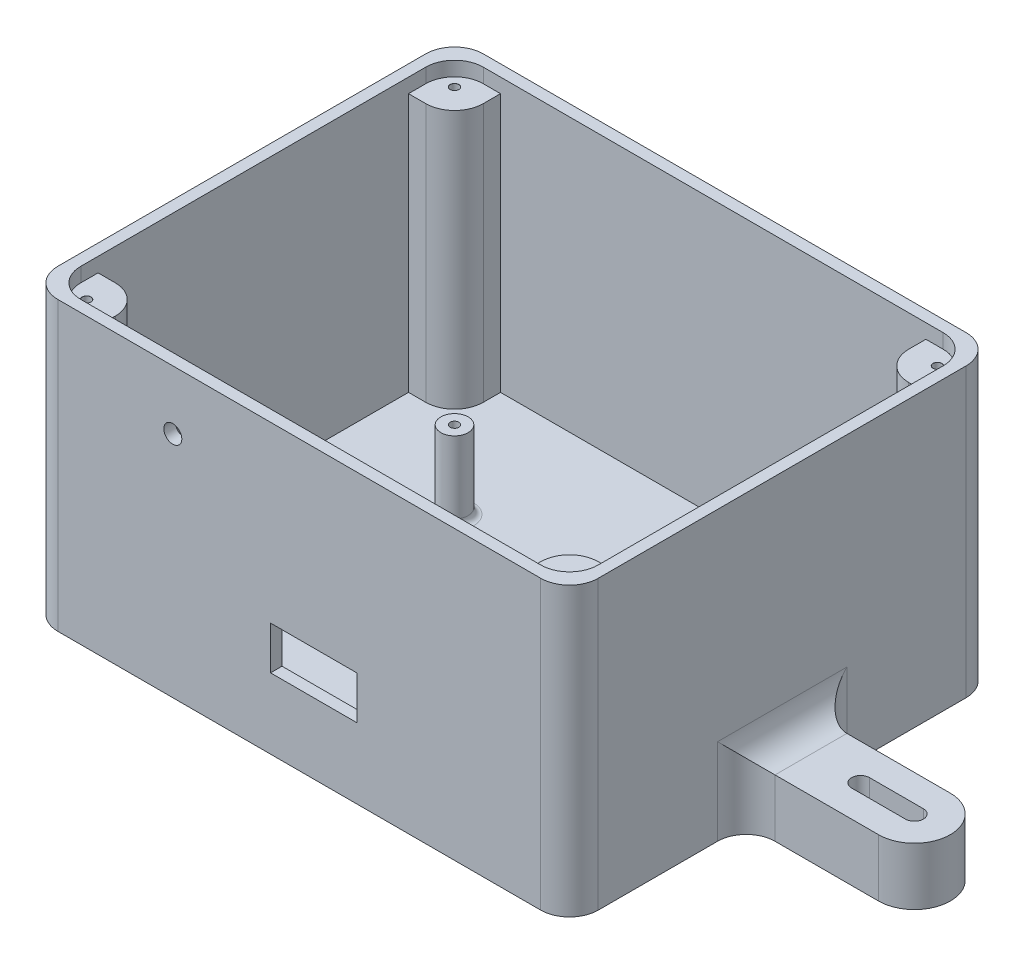
from build123d import *

# Parameters (mm, degrees)
ESBO_O1_W                                  = 4.75
ESBO_O1_H                                  = 1
REVOLU_O1_ANGLE                            = 180
ESBO_O2_W                                  = 9.5
ESBO_O2_H                                  = 74
RESSALTO_EXTRUS_O1_DEPTH                   = 8.75
ESBO_O3_W                                  = 8.75
ESBO_O3_H                                  = 73
CORTE_EXTRUS_O1_DEPTH                      = 1.5
ESBO_O4_W                                  = 8
ESBO_O4_H                                  = 73
CORTE_EXTRUS_O2_DEPTH                      = 4.75
ESBO_O5_W                                  = 4
ESBO_O5_H                                  = 68
RESSALTO_EXTRUS_O2_DEPTH                   = 52
ESBO_O6_W                                  = 4
ESBO_O6_H                                  = 74
RESSALTO_EXTRUS_O3_DEPTH                   = 80
ESBO_O7_W                                  = 4
ESBO_O7_H                                  = 74
RESSALTO_EXTRUS_O4_DEPTH                   = 40
ESBO_O8_W                                  = 144
ESBO_O8_H                                  = 74
RESSALTO_EXTRUS_O5_DEPTH                   = 4
ESBO_O9_W                                  = 144
ESBO_O9_H                                  = 74
RESSALTO_EXTRUS_O6_DEPTH                   = 4
ESBO_O10_W                                 = 188
ESBO_O10_H                                 = 74
RESSALTO_EXTRUS_O7_DEPTH                   = 4
ESBO_O11_W                                 = 188
ESBO_O11_H                                 = 148
RESSALTO_EXTRUS_O8_DEPTH                   = 26
CORTE_EXTRUS_O3_DEPTH                      = 21
RESSALTO_EXTRUS_O9_DEPTH                   = 20
CORTE_EXTRUS_O4_DEPTH                      = 268.847437919
RESSALTO_EXTRUS_O10_DEPTH                  = 20
CORTE_EXTRUS_O5_DEPTH                      = 262.040705638
ESBO_O17_W                                 = 16
ESBO_O17_H                                 = 16
RESSALTO_EXTRUS_O11_DEPTH                  = 90
ESBO_O18_W                                 = 16
ESBO_O18_H                                 = 16
RESSALTO_EXTRUS_O12_DEPTH                  = 90
ESBO_O19_W                                 = 16
ESBO_O19_H                                 = 16
RESSALTO_EXTRUS_O13_DEPTH                  = 90
ESBO_O20_W                                 = 16
ESBO_O20_H                                 = 16
RESSALTO_EXTRUS_O14_DEPTH                  = 90
RESSALTO_EXTRUS_O15_DEPTH                  = 22
ESBO_O22_W                                 = 4.75
ESBO_O22_H                                 = 22
FURO_DE_DI_METRO_3_0_3_1_D                 = 3
FURO_DE_DI_METRO_3_0_3_1_DEPTH             = 15
FURO_DE_DI_METRO_3_0_3_1_TIP               = 0.901290929
FURO_DE_DI_METRO_3_0_3_2_D                 = 3
FURO_DE_DI_METRO_3_0_3_2_DEPTH             = 15
FURO_DE_DI_METRO_3_0_3_2_TIP               = 0.901290929
BROCA_DE_ROSQUEAR_PARA_HELICOIDE_M61_D     = 6.25
BROCA_DE_ROSQUEAR_PARA_HELICOIDE_M61_DEPTH = 4
CHANFRO1_SIZE                              = 0.025
FILETE1_R                                  = 2
FILETE2_R                                  = 10
ESBO_O35_W                                 = 4.75
ESBO_O35_H                                 = 22
FILETE3_R                                  = 2
ESBO_O43_W                                 = 52
ESBO_O43_H                                 = 6
RESSALTO_EXTRUS_O16_DEPTH                  = 4
ESBO_O44_R                                 = 4.75
ESBO_O44_R_2                               = 1.525
RESSALTO_EXTRUS_O17_DEPTH                  = 5
ESBO_O47_W                                 = 30
ESBO_O47_H                                 = 15
CORTE_EXTRUS_O7_DEPTH                      = 10


with BuildPart() as part:
    # Esboço1 → Revolução1 (revolve)
    with BuildSketch(Plane.XY.offset(-4.75)):
        with Locations((97.625, 26.5)):
            Rectangle(ESBO_O1_W, ESBO_O1_H)
    revolve(axis=Axis((95.25, 27, -4.75), (0, 1, 0)), revolution_arc=REVOLU_O1_ANGLE)

    # Esboço2 → Ressalto-extrusão1 (add)
    with BuildSketch(Plane.XY.offset(-4.75)):
        with Locations((95.25, 63)):
            Rectangle(ESBO_O2_W, ESBO_O2_H)
    extrude(amount=RESSALTO_EXTRUS_O1_DEPTH)

    # Esboço3 → Corte-extrusão1 (cut)
    with BuildSketch(Plane.ZY.offset(-90.5)):
        with Locations((-0.375, 63.5)):
            Rectangle(ESBO_O3_W, ESBO_O3_H)
    extrude(amount=-CORTE_EXTRUS_O1_DEPTH, mode=Mode.SUBTRACT)

    # Esboço4 → Corte-extrusão2 (cut)
    with BuildSketch(Plane(origin=(0, 0, -4.75), x_dir=(-1, 0, 0), z_dir=(0, 0, -1))):
        with Locations((-96, 63.5)):
            Rectangle(ESBO_O4_W, ESBO_O4_H)
    extrude(amount=-CORTE_EXTRUS_O2_DEPTH, mode=Mode.SUBTRACT)

    # Esboço5 → Ressalto-extrusão2 (add)
    with BuildSketch(Plane.ZY.offset(-92)):
        with Locations((2, 66)):
            Rectangle(ESBO_O5_W, ESBO_O5_H)
    extrude(amount=RESSALTO_EXTRUS_O2_DEPTH)

    # Esboço6 → Ressalto-extrusão3 (add)
    with BuildSketch(Plane.ZY.offset(-40)):
        with Locations((2, 63)):
            Rectangle(ESBO_O6_W, ESBO_O6_H)
    extrude(amount=RESSALTO_EXTRUS_O3_DEPTH)

    # Esboço7 → Ressalto-extrusão4 (add)
    with BuildSketch(Plane(origin=(100, 0, 0), x_dir=(0, 0, -1), z_dir=(1, 0, 0))):
        with Locations((-2, 63)):
            Rectangle(ESBO_O7_W, ESBO_O7_H)
    extrude(amount=RESSALTO_EXTRUS_O4_DEPTH)

    # Esboço8 → Ressalto-extrusão5 (add)
    with BuildSketch(Plane(origin=(140, 0, 0), x_dir=(0, 0, -1), z_dir=(1, 0, 0))):
        with Locations((68, 63)):
            Rectangle(ESBO_O8_W, ESBO_O8_H)
    extrude(amount=RESSALTO_EXTRUS_O5_DEPTH)

    # Esboço9 → Ressalto-extrusão6 (add)
    with BuildSketch(Plane.ZY.offset(40)):
        with Locations((-68, 63)):
            Rectangle(ESBO_O9_W, ESBO_O9_H)
    extrude(amount=RESSALTO_EXTRUS_O6_DEPTH)

    # Esboço10 → Ressalto-extrusão7 (add)
    with BuildSketch(Plane(origin=(0, 0, -140), x_dir=(-1, 0, 0), z_dir=(0, 0, -1))):
        with Locations((-50, 63)):
            Rectangle(ESBO_O10_W, ESBO_O10_H)
    extrude(amount=RESSALTO_EXTRUS_O7_DEPTH)

    # Esboço11 → Ressalto-extrusão8 (add)
    with BuildSketch(Plane.XZ.offset(-26)):
        with Locations((50, -70)):
            Rectangle(ESBO_O11_W, ESBO_O11_H)
    extrude(amount=RESSALTO_EXTRUS_O8_DEPTH)

    # Esboço12 → Corte-extrusão3 (cut)
    with BuildSketch(Plane(origin=(0, 26, 0), x_dir=(-1, 0, 0), z_dir=(0, 1, 0))):
        with BuildLine():
            Line((-140, -140), (40, -140))
            Line((40, -140), (40, 0))
            Line((40, 0), (-90.5, 0))
            Line((-90.5, 0), (-90.5, -4.75))
            ThreePointArc((-90.5, -4.75), (-95.25, -9.5), (-100, -4.75))
            Line((-100, -4.75), (-100, 0))
            Line((-100, 0), (-140, 0))
            Line((-140, 0), (-140, -140))
        make_face()
    extrude(amount=-CORTE_EXTRUS_O3_DEPTH, mode=Mode.SUBTRACT)

    # Esboço13 → Ressalto-extrusão9 (add)
    with BuildSketch(Plane.XZ):
        with BuildLine():
            Line((144, -82.5), (190, -82.5))
            ThreePointArc((190, -82.5), (202.5, -70), (190, -57.5))
            Line((190, -57.5), (144, -57.5))
            Line((144, -57.5), (144, -82.5))
        make_face()
    extrude(amount=-RESSALTO_EXTRUS_O9_DEPTH)

    # Esboço14 → Corte-extrusão4 (cut, through all)
    with BuildSketch(Plane.XZ):
        with BuildLine():
            Line((190, -66.875), (171.25, -66.875))
            ThreePointArc((171.25, -66.875), (168.125, -70), (171.25, -73.125))
            Line((171.25, -73.125), (190, -73.125))
            ThreePointArc((190, -73.125), (193.125, -70), (190, -66.875))
        make_face()
    extrude(amount=-CORTE_EXTRUS_O4_DEPTH, mode=Mode.SUBTRACT)

    # Esboço15 → Ressalto-extrusão10 (add)
    with BuildSketch(Plane.XZ):
        with BuildLine():
            Line((-44, -57.5), (-90, -57.5))
            ThreePointArc((-90, -57.5), (-102.5, -70), (-90, -82.5))
            Line((-90, -82.5), (-44, -82.5))
            Line((-44, -82.5), (-44, -57.5))
        make_face()
    extrude(amount=-RESSALTO_EXTRUS_O10_DEPTH)

    # Esboço16 → Corte-extrusão5 (cut, through all)
    with BuildSketch(Plane(origin=(0, 20, 0), x_dir=(-1, 0, 0), z_dir=(0, 1, 0))):
        with BuildLine():
            Line((71.25, -73.125), (90, -73.125))
            ThreePointArc((90, -73.125), (93.125, -70), (90, -66.875))
            Line((90, -66.875), (71.25, -66.875))
            ThreePointArc((71.25, -66.875), (68.125, -70), (71.25, -73.125))
        make_face()
    extrude(amount=-CORTE_EXTRUS_O5_DEPTH, mode=Mode.SUBTRACT)

    # Esboço17 → Ressalto-extrusão11 (add)
    with BuildSketch(Plane(origin=(0, 5, 0), x_dir=(-1, 0, 0), z_dir=(0, 1, 0))):
        with Locations((32, -132)):
            Rectangle(ESBO_O17_W, ESBO_O17_H)
    extrude(amount=RESSALTO_EXTRUS_O11_DEPTH)

    # Esboço18 → Ressalto-extrusão12 (add)
    with BuildSketch(Plane(origin=(0, 5, 0), x_dir=(-1, 0, 0), z_dir=(0, 1, 0))):
        with Locations((-132, -132)):
            Rectangle(ESBO_O18_W, ESBO_O18_H)
    extrude(amount=RESSALTO_EXTRUS_O12_DEPTH)

    # Esboço19 → Ressalto-extrusão13 (add)
    with BuildSketch(Plane(origin=(0, 5, 0), x_dir=(-1, 0, 0), z_dir=(0, 1, 0))):
        with Locations((-132, -8)):
            Rectangle(ESBO_O19_W, ESBO_O19_H)
    extrude(amount=RESSALTO_EXTRUS_O13_DEPTH)

    # Esboço20 → Ressalto-extrusão14 (add)
    with BuildSketch(Plane(origin=(0, 5, 0), x_dir=(-1, 0, 0), z_dir=(0, 1, 0))):
        with Locations((32, -8)):
            Rectangle(ESBO_O20_W, ESBO_O20_H)
    extrude(amount=RESSALTO_EXTRUS_O14_DEPTH)

    # Esboço21 → Ressalto-extrusão15 (add)
    with BuildSketch(Plane(origin=(0, 5, 0), x_dir=(-1, 0, 0), z_dir=(0, 1, 0))):
        with BuildLine():
            Line((-9.5, -4.75), (-9.5, 0))
            Line((-9.5, 0), (0, 0))
            Line((0, 0), (0, -4.75))
            ThreePointArc((0, -4.75), (-4.75, -9.5), (-9.5, -4.75))
        make_face()
    extrude(amount=RESSALTO_EXTRUS_O15_DEPTH)

    # Esboço22 → Revolução2 (revolve)
    with BuildSketch(Plane.XY.offset(-95.25)):
        with Locations((7.125, 16)):
            Rectangle(ESBO_O22_W, ESBO_O22_H)
    revolve(axis=Axis((4.75, 27, -95.25), (0, -1, 0)))

    # Furo de diâmetro Ø3.0 (3)1
    with Locations(Plane(origin=(0, 95, 0), x_dir=(1, 0, 0), z_dir=(0, 1, 0))):
        with Locations((-34, 6), (134, 6), (134, 134), (-34, 134)):
            Hole(FURO_DE_DI_METRO_3_0_3_1_D / 2, depth=FURO_DE_DI_METRO_3_0_3_1_DEPTH)
            with Locations((0, 0, -(FURO_DE_DI_METRO_3_0_3_1_DEPTH + FURO_DE_DI_METRO_3_0_3_1_TIP / 2))):  # 118° drill point
                Cone(0, FURO_DE_DI_METRO_3_0_3_1_D / 2, FURO_DE_DI_METRO_3_0_3_1_TIP, mode=Mode.SUBTRACT)

    # Furo de diâmetro Ø3.0 (3)2
    with Locations(Plane(origin=(0, 27, 0), x_dir=(1, 0, 0), z_dir=(0, 1, 0))):
        with Locations((95.25, 4.75), (4.75, 4.75), (4.75, 95.25)):
            Hole(FURO_DE_DI_METRO_3_0_3_2_D / 2, depth=FURO_DE_DI_METRO_3_0_3_2_DEPTH)
            with Locations((0, 0, -(FURO_DE_DI_METRO_3_0_3_2_DEPTH + FURO_DE_DI_METRO_3_0_3_2_TIP / 2))):  # 118° drill point
                Cone(0, FURO_DE_DI_METRO_3_0_3_2_D / 2, FURO_DE_DI_METRO_3_0_3_2_TIP, mode=Mode.SUBTRACT)

    # Broca de rosquear para helicoide M61
    with Locations(Plane.XY.offset(4)):
        with Locations((6, 79.5)):
            Hole(BROCA_DE_ROSQUEAR_PARA_HELICOIDE_M61_D / 2, depth=BROCA_DE_ROSQUEAR_PARA_HELICOIDE_M61_DEPTH)

    # Chanfro1
    chanfro1_edges = [part.edges().sort_by_distance(p)[0] for p in [
        (96.75, 27, -4.75),
        (6.25, 27, -95.25),
        (135.5, 95, -6),
        (-32.5, 95, -6),
        (6.25, 27, -4.75),
        (135.5, 95, -134),
        (-32.5, 95, -134),
    ]]
    chamfer(chanfro1_edges, length=CHANFRO1_SIZE)

    # Filete1
    filete1_edges = [part.edges().sort_by_distance(p)[0] for p in [
        (92, 32, 2),
        (40, 26, 2),
        (40, 32, 2),
    ]]
    fillet(filete1_edges, radius=FILETE1_R)

    # Filete2
    filete2_edges = [part.edges().sort_by_distance(p)[0] for p in [
        (124, 50, -124),
        (-44, 10, -82.5),
        (-44, 20, -70),
        (-44, 10, -57.5),
        (144, 10, -82.5),
        (144, 10, -57.5),
        (144, 20, -70),
        (140, 97.5, -140),
        (140, 97.5, 0),
        (-24, 50, -16),
        (-40, 97.5, 0),
        (-40, 97.5, -140),
        (144, 50, -144),
        (-24, 50, -124),
        (-44, 50, -144),
        (124, 50, -16),
        (-44, 50, 4),
        (144, 50, 4),
    ]]
    fillet(filete2_edges, radius=FILETE2_R)

    # Esboço35 → Revolução3 (revolve)
    with BuildSketch(Plane.XY.offset(-95.25)):
        with Locations((97.625, 16)):
            Rectangle(ESBO_O35_W, ESBO_O35_H)
    revolve(axis=Axis((95.25, 27, -95.25), (0, -1, 0)))

    # Esboço42 → Corte-Revolução1 (revolve, cut)
    with BuildSketch(Plane.XY.offset(-95.25)):
        Polygon((96.775, 27), (95.25, 27), (95.25, 11.098709071), (96.75, 12), (96.75, 26.975), align=None)
    revolve(axis=Axis((95.25, 27, -95.25), (0, -1, 0)), mode=Mode.SUBTRACT)

    # Filete3
    filete3_edges = [part.edges().sort_by_distance(p)[0] for p in [
        (0, 5, -2.375),
        (9.5, 5, -2.375),
        (4.75, 5, -9.5),
        (100, 5, -2.375),
        (95.25, 5, -9.5),
        (90.5, 5, -2.375),
        (90.5, 5, -95.25),
        (0, 5, -95.25),
    ]]
    fillet(filete3_edges, radius=FILETE3_R)

    # Esboço43 → Ressalto-extrusão16 (add)
    with BuildSketch(Plane.XY.offset(4)):
        with Locations((66, 29)):
            Rectangle(ESBO_O43_W, ESBO_O43_H)
    extrude(amount=-RESSALTO_EXTRUS_O16_DEPTH)

    # Esboço44 → Ressalto-extrusão17 (add, symmetric)
    # profile 1 of 4: a face of its own
    with BuildSketch(Plane(origin=(0, 27, 0), x_dir=(-1, 0, 0), z_dir=(0, 1, 0))):
        with Locations((-4.75, -95.25)):
            Circle(ESBO_O44_R)
        with Locations((-4.75, -95.25)):
            Circle(ESBO_O44_R_2, mode=Mode.SUBTRACT)
    # profile 2 of 4: a face of its own
    with BuildSketch(Plane(origin=(0, 27, 0), x_dir=(-1, 0, 0), z_dir=(0, 1, 0))):
        with Locations((-95.25, -95.25)):
            Circle(ESBO_O44_R)
        with Locations((-95.25, -95.25)):
            Circle(ESBO_O44_R_2, mode=Mode.SUBTRACT)
    # profile 3 of 4: a face of its own
    with BuildSketch(Plane(origin=(0, 27, 0), x_dir=(-1, 0, 0), z_dir=(0, 1, 0))):
        with BuildLine():
            Line((-9.5, -4.75), (-9.5, 0))
            Line((-9.5, 0), (0, 0))
            Line((0, 0), (0, -4.75))
            ThreePointArc((0, -4.75), (-4.75, -9.5), (-9.5, -4.75))
        make_face()
        with Locations((-4.75, -4.75)):
            Circle(ESBO_O44_R_2, mode=Mode.SUBTRACT)
    # profile 4 of 4: a face of its own
    with BuildSketch(Plane(origin=(0, 27, 0), x_dir=(-1, 0, 0), z_dir=(0, 1, 0))):
        with BuildLine():
            Line((-100, 0), (-100, -4.75))
            ThreePointArc((-100, -4.75), (-95.25, -9.5), (-90.5, -4.75))
            Line((-90.5, -4.75), (-90.5, 0))
            Line((-90.5, 0), (-100, 0))
        make_face()
        with Locations((-95.25, -4.75)):
            Circle(ESBO_O44_R_2, mode=Mode.SUBTRACT)
    extrude(amount=RESSALTO_EXTRUS_O17_DEPTH, both=True)

    # Esboço47 → Corte-extrusão7 (cut)
    with BuildSketch(Plane.XY.offset(4)):
        with Locations((55, 32)):
            Rectangle(ESBO_O47_W, ESBO_O47_H)
    extrude(amount=-CORTE_EXTRUS_O7_DEPTH, mode=Mode.SUBTRACT)


solid = part.part
